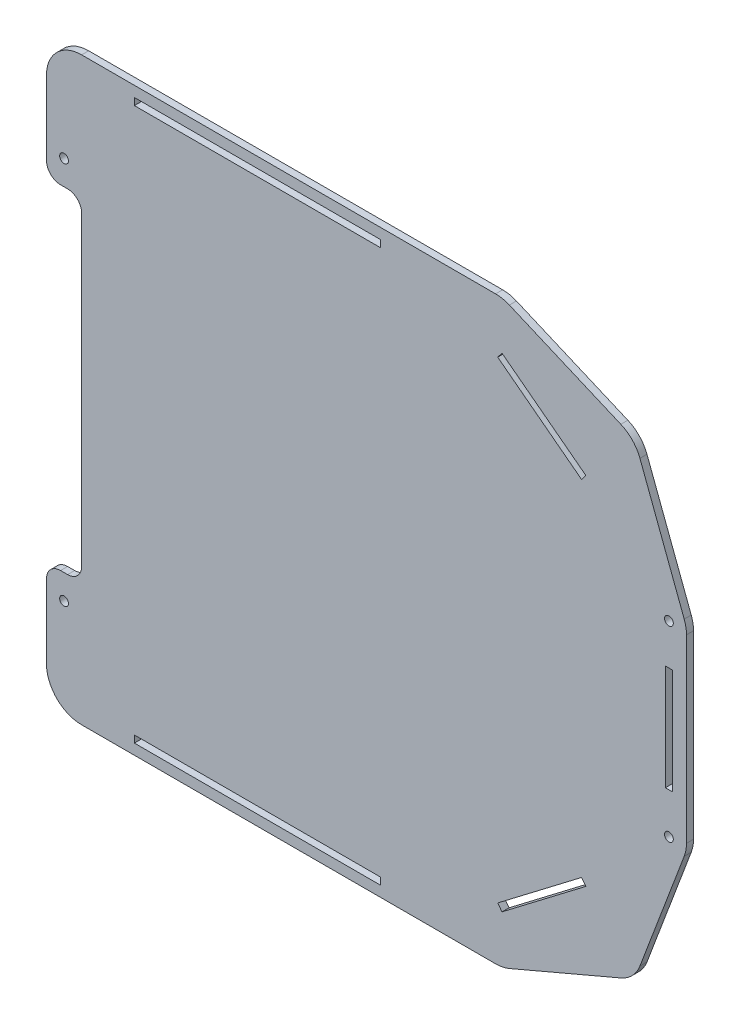
from build123d import *

# Parameters (mm, degrees)
ESTRUSIONE_ESTRUSIONE1_DEPTH = 2
FORO_FILETTATO_M3X0_5_1_D    = 2.5
SCHIZZO4_W                   = 70
SCHIZZO4_H                   = 2
TAGLIO_ESTRUSIONE1_DEPTH     = 10
FORO_FILETTATO_M3X0_5_2_D    = 2.5
SCHIZZO7_W                   = 2
SCHIZZO7_H                   = 30
TAGLIO_ESTRUSIONE2_DEPTH     = 10
SCHIZZO8_W                   = 10
SCHIZZO8_H                   = 95
TAGLIO_ESTRUSIONE3_DEPTH     = 10
RACCORDO1_R                  = 10
RACCORDO2_R                  = 10
RACCORDO3_R                  = 4


with BuildPart() as part:
    # Schizzo1 → Estrusione-Estrusione1 (new body)
    with BuildSketch(Plane.XY):
        Polygon((38.754390671, -82.5), (76.25322063, -66.50771119), (91, -27.5), (91, 27.5), (76.25322063, 66.50771119), (38.754390671, 82.5), (-91, 82.5), (-91, -82.5), align=None)
    extrude(amount=ESTRUSIONE_ESTRUSIONE1_DEPTH)

    # Foro filettato M3x0.5-1 (through all)
    with Locations(Plane(origin=(0, 0, 0), x_dir=(-1, 0, 0), z_dir=(0, 0, -1))):
        with Locations((86, -54.5), (86, 54.5)):
            Hole(FORO_FILETTATO_M3X0_5_1_D / 2)

    # Schizzo4 → Taglio-Estrusione1 (cut)
    with BuildSketch(Plane(origin=(0, 0, 0), x_dir=(-1, 0, 0), z_dir=(0, 0, -1))):
        with Locations((31, -78.5)):
            Rectangle(SCHIZZO4_W, SCHIZZO4_H)
        with Locations((31, 78.5)):
            Rectangle(SCHIZZO4_W, SCHIZZO4_H)
    extrude(amount=-TAGLIO_ESTRUSIONE1_DEPTH, mode=Mode.SUBTRACT)

    # Foro filettato M3x0.5-2 (through all)
    with Locations(Plane.XY.offset(2)):
        with Locations((86, 26.586432577), (86, -26.586432577)):
            Hole(FORO_FILETTATO_M3X0_5_2_D / 2)

    # Schizzo7 → Taglio-Estrusione2 (cut)
    with BuildSketch(Plane.XY.offset(2)):
        Polygon((38.536156503, 68.79802257), (62.384284835, 50.597287007), (61.170902464, 49.007411784), (37.322774132, 67.208147347), align=None)
        Polygon((61.170902464, -49.007411784), (37.322774132, -67.208147347), (38.536156503, -68.79802257), (62.384284835, -50.597287007), align=None)
        with Locations((86, 0)):
            Rectangle(SCHIZZO7_W, SCHIZZO7_H)
    extrude(amount=-TAGLIO_ESTRUSIONE2_DEPTH, mode=Mode.SUBTRACT)

    # Schizzo8 → Taglio-Estrusione3 (cut)
    with BuildSketch(Plane.XY.offset(2)):
        with Locations((-86, 0)):
            Rectangle(SCHIZZO8_W, SCHIZZO8_H)
    extrude(amount=-TAGLIO_ESTRUSIONE3_DEPTH, mode=Mode.SUBTRACT)

    # Raccordo1
    raccordo1_edges = [part.edges().sort_by_distance(p)[0] for p in [
        (-91, 82.5, 1),
        (-91, -82.5, 1),
    ]]
    fillet(raccordo1_edges, radius=RACCORDO1_R)

    # Raccordo2
    raccordo2_edges = [part.edges().sort_by_distance(p)[0] for p in [
        (38.754390671, -82.5, 1),
        (76.25322063, -66.50771119, 1),
        (91, -27.5, 1),
        (91, 27.5, 1),
        (76.25322063, 66.50771119, 1),
        (38.754390671, 82.5, 1),
    ]]
    fillet(raccordo2_edges, radius=RACCORDO2_R)

    # Raccordo3
    raccordo3_edges = [part.edges().sort_by_distance(p)[0] for p in [
        (-81, 47.5, 1),
        (-91, 47.5, 1),
        (-81, -47.5, 1),
        (-91, -47.5, 1),
    ]]
    fillet(raccordo3_edges, radius=RACCORDO3_R)


solid = part.part
